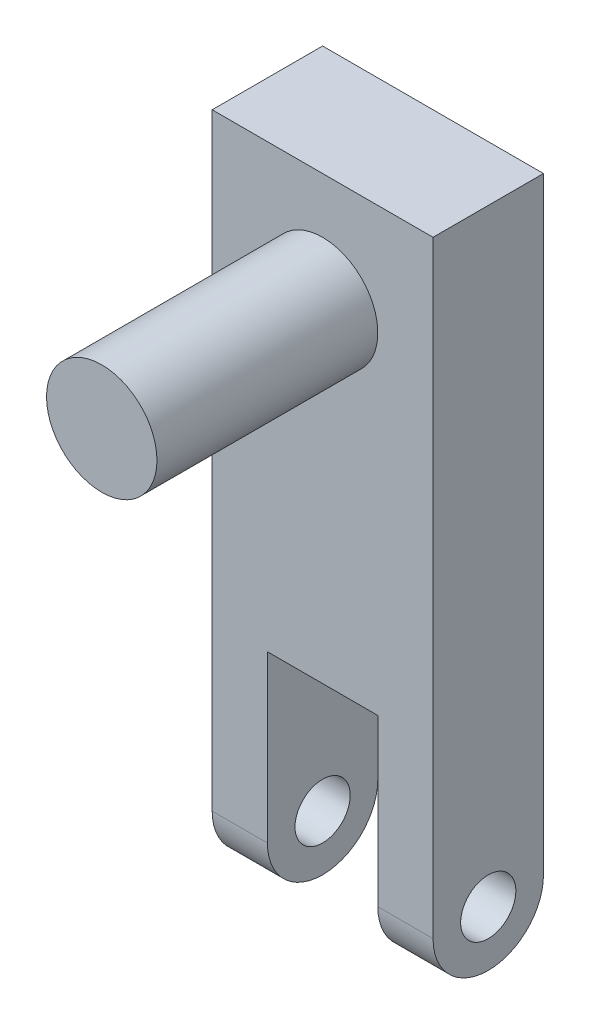
from build123d import *

# Parameters (mm, degrees)
BOSS_EXTRUDE1_DEPTH     = 6.35
FILLET1_R               = 3.175
CUT_EXTRUDE1_DEPTH      = 40.144028919
CUT_EXTRUDE1_DEPTH_BACK = 40.144028919
SKETCH2_R               = 1.5875
SKETCH3_R               = 3.175
BOSS_EXTRUDE2_DEPTH     = 12.7


with BuildPart() as part:
    # Sketch1 → Boss-Extrude1 (new body)
    with BuildSketch(Plane.XY):
        Polygon((3.175, 0), (6.35, 0), (6.35, 38.1), (-6.35, 38.1), (-6.35, 0), (-3.175, 0), (-3.175, 12.7), (3.175, 12.7), align=None)
    extrude(amount=BOSS_EXTRUDE1_DEPTH)

    # Fillet1
    fillet1_edges = [part.edges().sort_by_distance(p)[0] for p in [
        (-4.7625, 0, 0),
        (-4.7625, 0, 6.35),
        (4.7625, 0, 0),
        (4.7625, 0, 6.35),
    ]]
    fillet(fillet1_edges, radius=FILLET1_R - 0.0001)  # a hair under: the kernel refuses the full size

    # Sketch2 → Cut-Extrude1 (cut, two sides: drawn at the far end of the back side and taken through both)
    with BuildSketch(Plane(origin=(0, 0, 0), x_dir=(0, 0, -1), z_dir=(1, 0, 0)).offset(-CUT_EXTRUDE1_DEPTH_BACK)):
        with Locations((-3.175, 3.175)):
            Circle(SKETCH2_R)
    extrude(amount=CUT_EXTRUDE1_DEPTH + CUT_EXTRUDE1_DEPTH_BACK, mode=Mode.SUBTRACT)

    # Sketch3 → Boss-Extrude2 (add)
    with BuildSketch(Plane.XY.offset(6.35)):
        with Locations(Location((0, 31.75, 0), (0, 0, 180))):
            Circle(SKETCH3_R)
    extrude(amount=BOSS_EXTRUDE2_DEPTH)


solid = part.part
